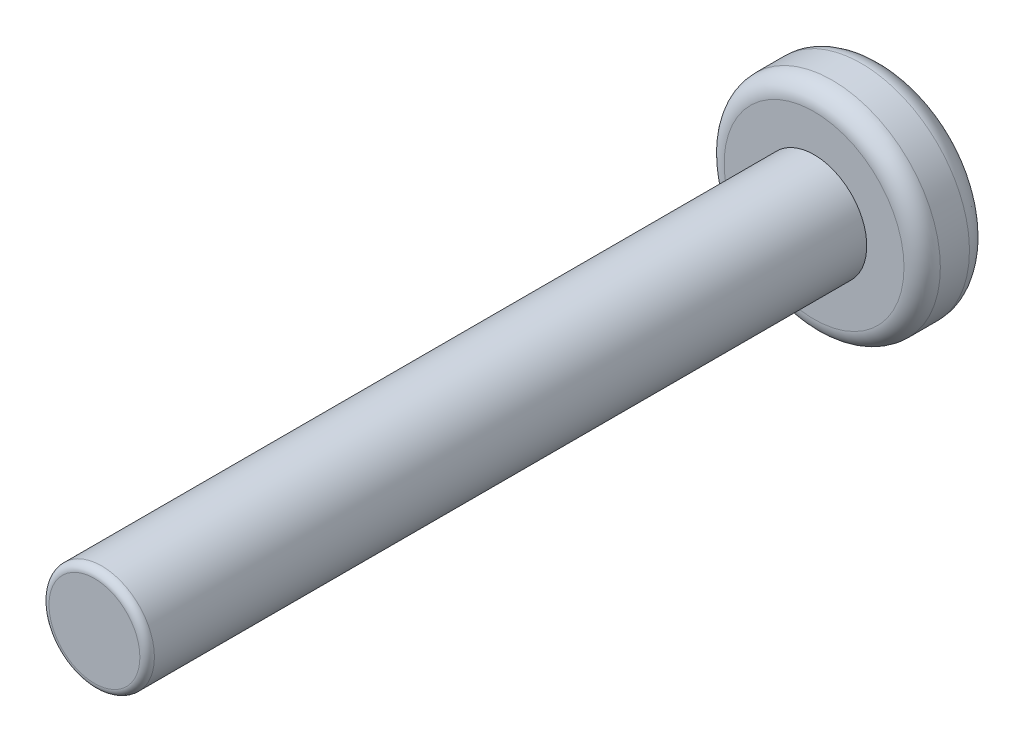
from build123d import *

# Parameters (mm, degrees)
ESBO_O1_R                = 2.975
RESSALTO_EXTRUS_O1_DEPTH = 2.3
FILETE1_SIZE             = 1
FILETE1_SIZE_2           = 2
FILETE2_R                = 0.5
CORTE_EXTRUS_O1_DEPTH    = 1.3
ESBO_O3_R                = 1.45
RESSALTO_EXTRUS_O2_DEPTH = 19.8
FILETE3_R                = 0.2


with BuildPart() as part:
    # Esboço1 → Ressalto-extrusão1 (new body)
    with BuildSketch(Plane.XY):
        Circle(ESBO_O1_R)
    extrude(amount=RESSALTO_EXTRUS_O1_DEPTH)

    # Filete1
    # an asymmetric fillet: 2, 1 mm, written as the material it takes off along each edge
    with BuildSketch(Plane(origin=(0, 0, 0), x_dir=(1, 0, 0), z_dir=(0, -1, 0))) as filete1_piece_1:
        with BuildLine():
            Bezier((2.975, FILETE1_SIZE), (2.975, 0), (2.975 - FILETE1_SIZE_2, 0), weights=[1, 0.707106781, 1])
            Line((2.975 - FILETE1_SIZE_2, 0), (2.975, 0))
            Line((2.975, 0), (2.975, FILETE1_SIZE))
        make_face()
    revolve(axis=Axis((0, 0, 0), (0, 0, 1)), mode=Mode.SUBTRACT)

    # Filete2
    filete2_edges = [part.edges().sort_by_distance(p)[0] for p in [
        (-2.975, 0, 2.3),
    ]]
    fillet(filete2_edges, radius=FILETE2_R)

    # Esboço2 → Corte-extrusão1 (cut)
    with BuildSketch(Plane(origin=(0, 0, 0), x_dir=(-1, 0, 0), z_dir=(0, 0, -1))):
        with BuildLine():
            Line((0.25, -2.25), (-0.25, -2.25))
            ThreePointArc((-0.25, -2.25), (-0.356066017, -2.206066017), (-0.4, -2.1))
            Line((-0.4, -2.1), (-0.4, -0.7))
            ThreePointArc((-0.4, -0.7), (-0.487867966, -0.487867966), (-0.7, -0.4))
            Line((-0.7, -0.4), (-2.1, -0.4))
            ThreePointArc((-2.1, -0.4), (-2.206066017, -0.356066017), (-2.25, -0.25))
            Line((-2.25, -0.25), (-2.25, 0.25))
            ThreePointArc((-2.25, 0.25), (-2.206066017, 0.356066017), (-2.1, 0.4))
            Line((-2.1, 0.4), (-0.7, 0.4))
            ThreePointArc((-0.7, 0.4), (-0.487867966, 0.487867966), (-0.4, 0.7))
            Line((-0.4, 0.7), (-0.4, 2.1))
            ThreePointArc((-0.4, 2.1), (-0.356066017, 2.206066017), (-0.25, 2.25))
            Line((-0.25, 2.25), (0.25, 2.25))
            ThreePointArc((0.25, 2.25), (0.356066017, 2.206066017), (0.4, 2.1))
            Line((0.4, 2.1), (0.4, 0.7))
            ThreePointArc((0.4, 0.7), (0.487867966, 0.487867966), (0.7, 0.4))
            Line((0.7, 0.4), (2.1, 0.4))
            ThreePointArc((2.1, 0.4), (2.206066017, 0.356066017), (2.25, 0.25))
            Line((2.25, 0.25), (2.25, -0.25))
            ThreePointArc((2.25, -0.25), (2.206066017, -0.356066017), (2.1, -0.4))
            Line((2.1, -0.4), (0.7, -0.4))
            ThreePointArc((0.7, -0.4), (0.487867966, -0.487867966), (0.4, -0.7))
            Line((0.4, -0.7), (0.4, -2.1))
            ThreePointArc((0.4, -2.1), (0.356066017, -2.206066017), (0.25, -2.25))
        make_face()
    extrude(amount=-CORTE_EXTRUS_O1_DEPTH, mode=Mode.SUBTRACT)

    # Esboço3 → Ressalto-extrusão2 (add)
    with BuildSketch(Plane.XY.offset(2.3)):
        with Locations(Location((0, 0, 0), (0, 0, 180))):
            Circle(ESBO_O3_R)
    extrude(amount=RESSALTO_EXTRUS_O2_DEPTH)

    # Filete3
    filete3_edges = [part.edges().sort_by_distance(p)[0] for p in [
        (1.45, 0, 22.1),
    ]]
    fillet(filete3_edges, radius=FILETE3_R)


solid = part.part
